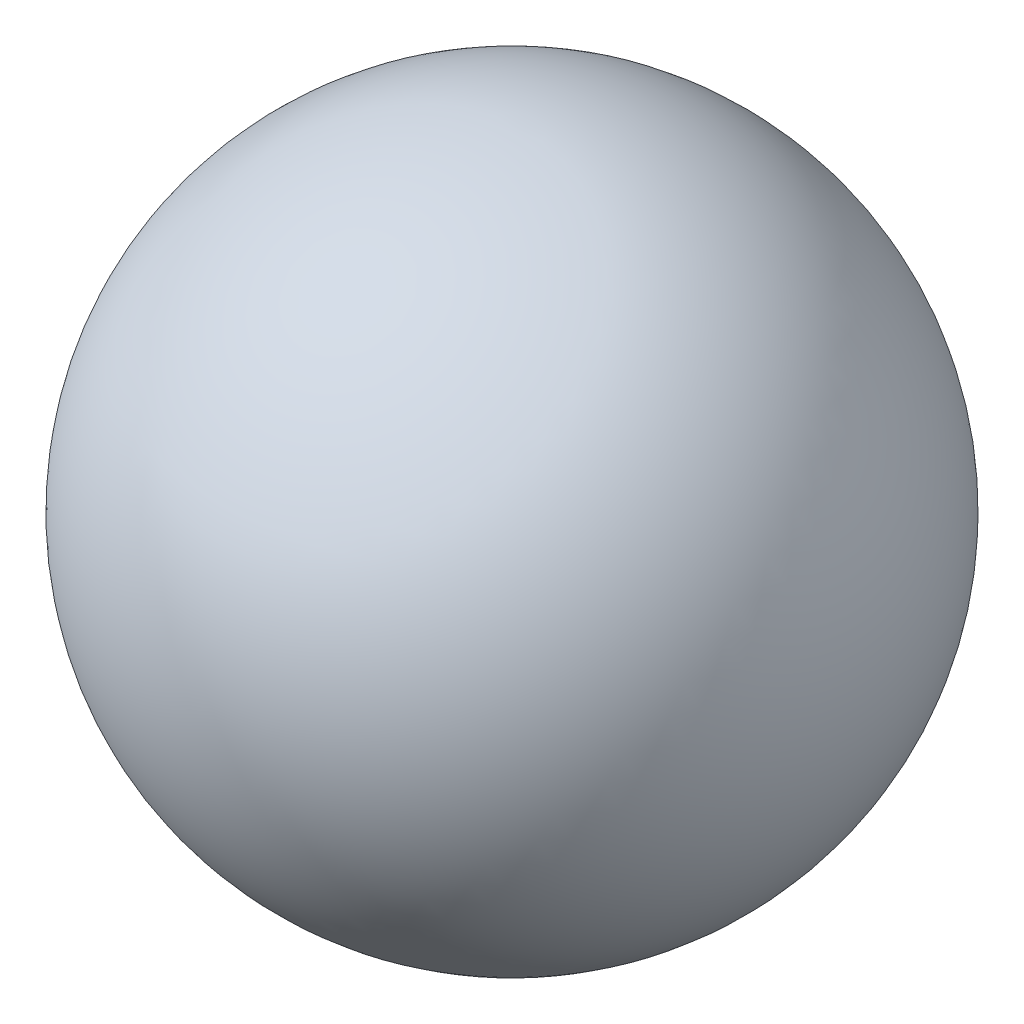
from build123d import *

# Parameters (mm, degrees)
SKETCH2_R          = 6.325
CUT_EXTRUDE1_DEPTH = 35
SKETCH3_R          = 5
CUT_EXTRUDE2_DEPTH = 30
FILLET1_R          = 5


with BuildPart() as part:
    # Sketch1 → Revolve1 (revolve)
    with BuildSketch(Plane.XY):
        with BuildLine():
            Line((0, 0), (0, 60))
            ThreePointArc((0, 60), (30, 30), (0, 0))
        make_face()
    revolve(axis=Axis((0, 0, 0), (0, 1, 0)))

    # Sketch2 → Cut-Extrude1 (cut)
    with BuildSketch(Plane.XY):
        with Locations((0, 30)):
            Circle(SKETCH2_R)
    extrude(amount=-CUT_EXTRUDE1_DEPTH, mode=Mode.SUBTRACT)

    # Sketch3 → Cut-Extrude2 (cut)
    with BuildSketch(Plane(origin=(0, 0, 0), x_dir=(1, 0, 0), z_dir=(0, 1, 0))):
        with Locations(Location((0, 0, 0), (0, 0, 180))):
            Circle(SKETCH3_R)
    extrude(amount=CUT_EXTRUDE2_DEPTH, mode=Mode.SUBTRACT)

    # Fillet1
    # the kernel refuses this fillet: 5 mm, written as the material it takes off along each edge
    with BuildSketch(Plane(origin=(17.5, 30, 0), x_dir=(0, 1, 0), z_dir=(-1, 0, 0))) as fillet1_piece_1_section:
        with BuildLine():
            CenterArc((FILLET1_R, -FILLET1_R), FILLET1_R, 90, 90)
            Line((0, -FILLET1_R), (0, 0))
            Line((0, 0), (FILLET1_R, 0))
        make_face()
    fillet1_piece_1 = extrude(amount=35, mode=Mode.PRIVATE)
    fillet1_piece_1 = fillet1_piece_1 & Plane(origin=(0, 31.17476679, 0), x_dir=(-1, 0, 0), z_dir=(0, -1, 0)) * Cylinder(5, 90, mode=Mode.PRIVATE)
    fillet1_piece_1 = fillet1_piece_1 & Plane(origin=(0, 30, 1.028849853), x_dir=(1, 0, 0), z_dir=(0, 0, 1)) * Cylinder(6.325, 90, mode=Mode.PRIVATE)
    add(fillet1_piece_1, mode=Mode.SUBTRACT)


solid = part.part
